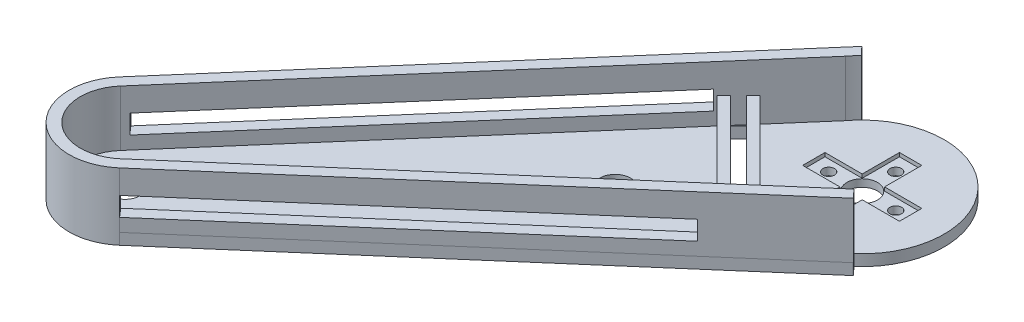
from build123d import *

# Parameters (mm, degrees)
SKETCH_2_R               = 2.1
SKETCH_2_R_2             = 4.1
EXTRUDE_2_DEPTH          = 3
EXTRUDE_3_DEPTH          = 15
SKETCH_4_R               = 4.1
SKETCH_4_R_2             = 2.1
EXTRUDE_4_DEPTH          = 10
EXTRUDE_START            = -13
EXTRUDE_5_DEPTH          = 13
SKETCH_7_R               = 1.3
CUT_EXTRUDE_1_DEPTH      = 13
CUT_EXTRUDE_2_DEPTH      = 174.68818701
CUT_EXTRUDE_2_DEPTH_BACK = 174.68818701
SKETCH_8_W               = 110
SKETCH_8_H               = 2.6
SKETCH_8_H_2             = 2.5
CUT_EXTRUDE_3_DEPTH      = 172.969913078
CUT_EXTRUDE_3_DEPTH_BACK = 172.969913078
EXTRUDE_6_DEPTH          = 10
SKETCH_11_R              = 2
CUT_EXTRUDE_4_DEPTH      = 10
SKETCH_13_R              = 2.05
CUT_EXTRUDE_5_DEPTH      = 10
SKETCH_14_R              = 4.1
EXTRUDE_7_DEPTH          = 3
CUT_EXTRUDE_6_DEPTH      = 3
SKETCH_19_R              = 4.1
CUT_EXTRUDE_9_DEPTH      = 172.518660805
CUT_EXTRUDE_14_DEPTH     = 1
CUT_EXTRUDE_15_DEPTH     = 172.772090295


# Read off the part's stored shape, not the designer's step: 凸台-拉伸3, 凸台-拉伸5
with BuildPart() as part:
    # 草图2 → 凸台-拉伸2 (new body)
    with BuildSketch(Plane(origin=(0, 0, 0), x_dir=(1, 0, 0), z_dir=(0, 1, 0))):
        with BuildLine():
            Line((80.099742919, 115.241133642), (-11.337123868, 9.698254241))
            ThreePointArc((-11.337123868, 9.698254241), (-10.606601718, -10.730242528), (9.821895051, -11.460764678))
            Line((9.821895051, -11.460764678), (115.364774452, 79.976102109))
            ThreePointArc((115.364774452, 79.976102109), (115.409508589, 80.014950331), (115.454150533, 80.053904459))
            Line((115.454150533, 80.053904459), (113.400395441, 82.243526883))
            ThreePointArc((113.400395441, 82.243526883), (115.041169115, 113.92185113), (83.322768112, 114.310956698))
            Line((83.322768112, 114.310956698), (81.26901302, 116.500579122))
            ThreePointArc((81.26901302, 116.500579122), (80.673552706, 115.880906565), (80.099742919, 115.241133642))
        make_face()
        with Locations(Location((98.994949366, 98.871308556, 0), (0, 0, 270))):
            Circle(SKETCH_2_R, mode=Mode.SUBTRACT)
        with Locations(Location((0, -0.12364081, 0), (0, 0, 270))):
            Circle(SKETCH_2_R_2, mode=Mode.SUBTRACT)
        with Locations(Location((70.710678119, 70.587037309, 0), (0, 0, 270))):
            Circle(SKETCH_2_R_2, mode=Mode.SUBTRACT)
    extrude(amount=EXTRUDE_2_DEPTH)

    # 凸台-拉伸3 outline → 凸台-拉伸3 (add)
    with BuildSketch(Plane(origin=(0, 3, 0), x_dir=(1, 0, 0), z_dir=(0, 1, 0))):
        with BuildLine():
            ThreePointArc((-11.337123868, 9.698254241), (-10.606601718, -10.730242528), (9.821895051, -11.460764678))
            Line((9.821895051, -11.460764678), (115.454150533, 80.053904459))
            Line((115.454150533, 80.053904459), (113.400395441, 82.243526883))
            ThreePointArc((113.400395441, 82.243526883), (113.358376595, 82.207216674), (113.316266225, 82.171012648))
            Line((113.316266225, 82.171012648), (7.857534265, -9.193324116))
            ThreePointArc((7.857534265, -9.193324116), (-8.484829636, -8.609373899), (-9.07051987, 7.732927734))
            Line((-9.07051987, 7.732927734), (81.368262538, 112.03565098))
            ThreePointArc((81.368262538, 112.03565098), (82.306692779, 113.206652712), (83.322768112, 114.310956698))
            Line((83.322768112, 114.310956698), (81.26901302, 116.500579122))
            Line((81.26901302, 116.500579122), (-11.337123868, 9.698254241))
        make_face()
    extrude(amount=EXTRUDE_3_DEPTH)

    # 草图4 → 凸台-拉伸4 (add)
    with BuildSketch(Plane(origin=(0, 3, 0), x_dir=(1, 0, 0), z_dir=(0, 1, 0))):
        with Locations(Location((98.994949366, 98.871308556, 0), (0, 0, 270))):
            Circle(SKETCH_4_R)
        with Locations(Location((98.994949366, 98.871308556, 0), (0, 0, 270))):
            Circle(SKETCH_4_R_2, mode=Mode.SUBTRACT)
    extrude(amount=EXTRUDE_4_DEPTH)

    # 凸台-拉伸5 outline → 凸台-拉伸5 (add)
    with BuildSketch(Plane(origin=(0, 13, 0), x_dir=(1, 0, 0), z_dir=(0, 1, 0)).offset(EXTRUDE_START)):
        with BuildLine():
            ThreePointArc((101.094850935, 98.891640782), (100.479873606, 100.356232796), (99.015281592, 100.971210125))
            Line((99.015281592, 100.971210125), (101.094850935, 98.891640782))
        make_face()
    extrude(amount=EXTRUDE_5_DEPTH)

    # 草图7 → 切除-拉伸1 (cut)
    with BuildSketch(Plane(origin=(99.993245858, 0, -99.993245858), x_dir=(0.7071067811865475, 0, 0.7071067811865477), z_dir=(-0.7071067811865477, 0, 0.7071067811865475))):
        with Locations((0, 5)):
            Circle(SKETCH_7_R)
    extrude(amount=-CUT_EXTRUDE_1_DEPTH, mode=Mode.SUBTRACT)

    # 草图8 → 切除-拉伸2 (cut, two sides: drawn at the far end of the back side and taken through both)
    with BuildSketch(Plane(origin=(9.883107451, 0, 11.40773322), x_dir=(0.75580694217799, 0, -0.6547945220873159), z_dir=(0.6547945220873159, 0, 0.75580694217799)).offset(-CUT_EXTRUDE_2_DEPTH_BACK)):
        with Locations((54.959520341, 10.3)):
            Rectangle(SKETCH_8_W, SKETCH_8_H)
        with Locations((54.959520341, 7.75)):
            Rectangle(SKETCH_8_W, SKETCH_8_H_2)
    extrude(amount=CUT_EXTRUDE_2_DEPTH + CUT_EXTRUDE_2_DEPTH_BACK, mode=Mode.SUBTRACT)

    # 草图9 → 切除-拉伸3 (cut, two sides: drawn at the far end of the back side and taken through both)
    with BuildSketch(Plane.XZ.offset(-CUT_EXTRUDE_3_DEPTH_BACK)):
        Polygon((83.449732713, -83.303817091), (81.326556947, -81.184353794), (67.196801633, -95.338858899), (69.319977399, -97.458322196), align=None)
        Polygon((95.456312261, -67.02984869), (81.326556947, -81.184353794), (83.449732713, -83.303817091), (97.579488027, -69.149311987), align=None)
    extrude(amount=CUT_EXTRUDE_3_DEPTH + CUT_EXTRUDE_3_DEPTH_BACK, mode=Mode.SUBTRACT)

    # 草图10 → 凸台-拉伸6 (add)
    with BuildSketch(Plane(origin=(0, 3, 0), x_dir=(1, 0, 0), z_dir=(0, 1, 0))):
        Polygon((81.326556947, 81.184353794), (70.022752696, 92.507957878), (68.182667032, 90.671089687), (79.486471284, 79.347485603), align=None)
        Polygon((92.630361199, 69.86074971), (81.326556947, 81.184353794), (79.486471284, 79.347485603), (90.790275535, 68.02388152), align=None)
        Polygon((73.986014125, 96.464289366), (72.145928462, 94.627421175), (83.449732713, 83.303817091), (94.753536964, 71.980213008), (96.593622628, 73.817081198), align=None)
    extrude(amount=EXTRUDE_6_DEPTH)

    # 草图11 → 切除-拉伸4 (cut)
    with BuildSketch(Plane(origin=(85.289818377, 0, -85.140685282), x_dir=(-0.7064877657092933, 0, -0.707725255238988), z_dir=(0.707725255238988, 0, -0.7064877657092933))):
        with Locations((-9.96499851, 8)):
            Circle(SKETCH_11_R)
        with Locations((9.96499851, 8)):
            Circle(SKETCH_11_R)
    extrude(amount=-CUT_EXTRUDE_4_DEPTH, mode=Mode.SUBTRACT)

    # 草图13 → 切除-拉伸5 (cut)
    with BuildSketch(Plane(origin=(85.289818377, 0, -85.140685282), x_dir=(-0.7064877657092933, 0, -0.707725255238988), z_dir=(0.707725255238988, 0, -0.7064877657092933))):
        with Locations((-9.96499851, 8)):
            Circle(SKETCH_13_R)
        with Locations((9.964998511, 8)):
            Circle(SKETCH_13_R)
    extrude(amount=-CUT_EXTRUDE_5_DEPTH, mode=Mode.SUBTRACT)

    # 草图14 → 凸台-拉伸7 (add)
    with BuildSketch(Plane.XZ):
        with Locations((70.710678119, -70.587037309)):
            Circle(SKETCH_14_R)
    extrude(amount=-EXTRUDE_7_DEPTH)

    # 草图15 → 切除-拉伸6 (cut)
    with BuildSketch(Plane.XZ):
        with BuildLine():
            ThreePointArc((69.902009877, -65.719825747), (67.369828397, -61.931429637), (62.901061054, -62.822500095))
            Line((62.901061054, -62.822500095), (65.802009877, -65.719825747))
            Line((65.802009877, -65.719825747), (68.702958699, -68.617151398))
            ThreePointArc((68.702958699, -68.617151398), (69.590405987, -67.287644267), (69.902009877, -65.719825747))
        make_face()
        with BuildLine():
            Line((65.802009877, -65.719825747), (62.901061054, -62.822500095))
            ThreePointArc((62.901061054, -62.822500095), (62.904684226, -68.620774569), (68.702958699, -68.617151398))
            Line((68.702958699, -68.617151398), (65.802009877, -65.719825747))
        make_face()
    extrude(amount=-CUT_EXTRUDE_6_DEPTH, mode=Mode.SUBTRACT)

    # 草图19 → 切除-拉伸9 (cut, through all)
    with BuildSketch(Plane(origin=(0, 13, 0), x_dir=(1, 0, 0), z_dir=(0, 1, 0))):
        with Locations(Location((98.994949366, 98.871308556, 0), (0, 0, 270))):
            Circle(SKETCH_19_R)
    extrude(amount=-CUT_EXTRUDE_9_DEPTH, mode=Mode.SUBTRACT)

    # 草图22 → 切除-拉伸14 (cut)
    with BuildSketch(Plane(origin=(0, 3, 0), x_dir=(1, 0, 0), z_dir=(0, 1, 0))):
        with BuildLine():
            Line((95.994949366, 101.871308556), (85.994949366, 101.871308556))
            Line((85.994949366, 101.871308556), (85.994949366, 95.871308556))
            Line((85.994949366, 95.871308556), (95.994949366, 95.871308556))
            Line((95.994949366, 95.871308556), (95.994949366, 96.076670834))
            ThreePointArc((95.994949366, 96.076670834), (94.894949366, 98.871308556), (95.994949366, 101.665946279))
            Line((95.994949366, 101.665946279), (95.994949366, 101.871308556))
        make_face()
        with BuildLine():
            Line((95.994949366, 111.871308556), (95.994949366, 101.871308556))
            Line((95.994949366, 101.871308556), (96.200311644, 101.871308556))
            ThreePointArc((96.200311644, 101.871308556), (98.994949366, 102.971308556), (101.789587089, 101.871308556))
            Line((101.789587089, 101.871308556), (101.994949366, 101.871308556))
            Line((101.994949366, 101.871308556), (101.994949366, 111.871308556))
            Line((101.994949366, 111.871308556), (95.994949366, 111.871308556))
        make_face()
        with BuildLine():
            Line((111.994949366, 101.871308556), (101.994949366, 101.871308556))
            Line((101.994949366, 101.871308556), (101.994949366, 101.665946279))
            ThreePointArc((101.994949366, 101.665946279), (102.810050938, 100.372974298), (103.094949366, 98.871308556))
            ThreePointArc((103.094949366, 98.871308556), (102.810050938, 97.369642814), (101.994949366, 96.076670834))
            Line((101.994949366, 96.076670834), (101.994949366, 95.871308556))
            Line((101.994949366, 95.871308556), (111.994949366, 95.871308556))
            Line((111.994949366, 95.871308556), (111.994949366, 101.871308556))
        make_face()
        with BuildLine():
            Line((96.200311644, 95.871308556), (95.994949366, 95.871308556))
            Line((95.994949366, 95.871308556), (95.994949366, 85.871308556))
            Line((95.994949366, 85.871308556), (101.994949366, 85.871308556))
            Line((101.994949366, 85.871308556), (101.994949366, 95.871308556))
            Line((101.994949366, 95.871308556), (101.789587089, 95.871308556))
            ThreePointArc((101.789587089, 95.871308556), (98.994949366, 94.771308556), (96.200311644, 95.871308556))
        make_face()
        with BuildLine():
            Line((95.994949366, 96.076670834), (95.994949366, 95.871308556))
            Line((95.994949366, 95.871308556), (96.200311644, 95.871308556))
            ThreePointArc((96.200311644, 95.871308556), (96.095811563, 95.972170753), (95.994949366, 96.076670834))
        make_face()
        with BuildLine():
            ThreePointArc((101.994949366, 96.076670834), (101.894087169, 95.972170753), (101.789587089, 95.871308556))
            Line((101.789587089, 95.871308556), (101.994949366, 95.871308556))
            Line((101.994949366, 95.871308556), (101.994949366, 96.076670834))
        make_face()
        with BuildLine():
            Line((101.994949366, 101.871308556), (101.789587089, 101.871308556))
            ThreePointArc((101.789587089, 101.871308556), (101.894087169, 101.770446359), (101.994949366, 101.665946279))
            Line((101.994949366, 101.665946279), (101.994949366, 101.871308556))
        make_face()
        with BuildLine():
            Line((96.200311644, 101.871308556), (95.994949366, 101.871308556))
            Line((95.994949366, 101.871308556), (95.994949366, 101.665946279))
            ThreePointArc((95.994949366, 101.665946279), (96.095811563, 101.770446359), (96.200311644, 101.871308556))
        make_face()
    extrude(amount=-CUT_EXTRUDE_14_DEPTH, mode=Mode.SUBTRACT)

    # 草图24 → 切除-拉伸15 (cut, through all)
    with BuildSketch(Plane(origin=(0, 2, 0), x_dir=(1, 0, 0), z_dir=(0, 1, 0))):
        with BuildLine():
            ThreePointArc((90.128421588, 97.32706597), (91.137180066, 97.823544734), (91.544949366, 98.871308556))
            Line((91.544949366, 98.871308556), (89.994949366, 98.871308556))
            ThreePointArc((89.994949366, 98.871308556), (90.028379509, 98.096308556), (90.128421588, 97.32706597))
        make_face()
        with BuildLine():
            Line((89.994949366, 98.871308556), (91.544949366, 98.871308556))
            ThreePointArc((91.544949366, 98.871308556), (91.137180066, 99.919072379), (90.128421588, 100.415551143))
            ThreePointArc((90.128421588, 100.415551143), (90.028379509, 99.646308556), (89.994949366, 98.871308556))
        make_face()
        with BuildLine():
            ThreePointArc((90.128421588, 97.32706597), (90.028379509, 98.096308556), (89.994949366, 98.871308556))
            Line((89.994949366, 98.871308556), (88.444949366, 98.871308556))
            ThreePointArc((88.444949366, 98.871308556), (88.947185544, 97.729077856), (90.128421588, 97.32706597))
        make_face()
        with BuildLine():
            Line((88.444949366, 98.871308556), (89.994949366, 98.871308556))
            ThreePointArc((89.994949366, 98.871308556), (90.028379509, 99.646308556), (90.128421588, 100.415551143))
            ThreePointArc((90.128421588, 100.415551143), (88.947185544, 100.013539256), (88.444949366, 98.871308556))
        make_face()
        with BuildLine():
            ThreePointArc((98.994949366, 107.871308556), (99.769949366, 107.837878413), (100.539191953, 107.737836334))
            ThreePointArc((100.539191953, 107.737836334), (100.543509344, 107.804510386), (100.544949366, 107.871308556))
            ThreePointArc((100.544949366, 107.871308556), (100.090964877, 108.967324067), (98.994949366, 109.421308556))
            Line((98.994949366, 109.421308556), (98.994949366, 107.871308556))
        make_face()
        with BuildLine():
            ThreePointArc((98.994949366, 106.321308556), (100.042713189, 106.729077856), (100.539191953, 107.737836334))
            ThreePointArc((100.539191953, 107.737836334), (99.769949366, 107.837878413), (98.994949366, 107.871308556))
            Line((98.994949366, 107.871308556), (98.994949366, 106.321308556))
        make_face()
        with BuildLine():
            ThreePointArc((97.45070678, 107.737836334), (97.947185544, 106.729077856), (98.994949366, 106.321308556))
            Line((98.994949366, 106.321308556), (98.994949366, 107.871308556))
            ThreePointArc((98.994949366, 107.871308556), (98.219949366, 107.837878413), (97.45070678, 107.737836334))
        make_face()
        with BuildLine():
            ThreePointArc((97.45070678, 107.737836334), (98.219949366, 107.837878413), (98.994949366, 107.871308556))
            Line((98.994949366, 107.871308556), (98.994949366, 109.421308556))
            ThreePointArc((98.994949366, 109.421308556), (97.852718666, 108.919072379), (97.45070678, 107.737836334))
        make_face()
        with BuildLine():
            ThreePointArc((107.861477144, 100.415551143), (107.961519223, 99.646308556), (107.994949366, 98.871308556))
            Line((107.994949366, 98.871308556), (109.544949366, 98.871308556))
            ThreePointArc((109.544949366, 98.871308556), (109.042713189, 100.013539256), (107.861477144, 100.415551143))
        make_face()
        with BuildLine():
            ThreePointArc((107.861477144, 97.32706597), (107.961519223, 98.096308556), (107.994949366, 98.871308556))
            Line((107.994949366, 98.871308556), (106.444949366, 98.871308556))
            ThreePointArc((106.444949366, 98.871308556), (106.852718666, 97.823544734), (107.861477144, 97.32706597))
        make_face()
        with BuildLine():
            Line((106.444949366, 98.871308556), (107.994949366, 98.871308556))
            ThreePointArc((107.994949366, 98.871308556), (107.961519223, 99.646308556), (107.861477144, 100.415551143))
            ThreePointArc((107.861477144, 100.415551143), (106.852718666, 99.919072379), (106.444949366, 98.871308556))
        make_face()
        with BuildLine():
            Line((109.544949366, 98.871308556), (107.994949366, 98.871308556))
            ThreePointArc((107.994949366, 98.871308556), (107.961519223, 98.096308556), (107.861477144, 97.32706597))
            ThreePointArc((107.861477144, 97.32706597), (109.042713189, 97.729077856), (109.544949366, 98.871308556))
        make_face()
        with BuildLine():
            ThreePointArc((100.544949366, 89.871308556), (100.543509344, 89.938106726), (100.539191953, 90.004780778))
            ThreePointArc((100.539191953, 90.004780778), (99.769949366, 89.904738699), (98.994949366, 89.871308556))
            Line((98.994949366, 89.871308556), (98.994949366, 88.321308556))
            ThreePointArc((98.994949366, 88.321308556), (100.090964877, 88.775293045), (100.544949366, 89.871308556))
        make_face()
        with BuildLine():
            ThreePointArc((98.994949366, 89.871308556), (99.769949366, 89.904738699), (100.539191953, 90.004780778))
            ThreePointArc((100.539191953, 90.004780778), (100.042713189, 91.013539256), (98.994949366, 91.421308556))
            Line((98.994949366, 91.421308556), (98.994949366, 89.871308556))
        make_face()
        with BuildLine():
            Line((98.994949366, 89.871308556), (98.994949366, 91.421308556))
            ThreePointArc((98.994949366, 91.421308556), (97.947185544, 91.013539256), (97.45070678, 90.004780778))
            ThreePointArc((97.45070678, 90.004780778), (98.219949366, 89.904738699), (98.994949366, 89.871308556))
        make_face()
        with BuildLine():
            Line((98.994949366, 88.321308556), (98.994949366, 89.871308556))
            ThreePointArc((98.994949366, 89.871308556), (98.219949366, 89.904738699), (97.45070678, 90.004780778))
            ThreePointArc((97.45070678, 90.004780778), (97.852718666, 88.823544734), (98.994949366, 88.321308556))
        make_face()
    extrude(amount=-CUT_EXTRUDE_15_DEPTH, mode=Mode.SUBTRACT)


solid = part.part
